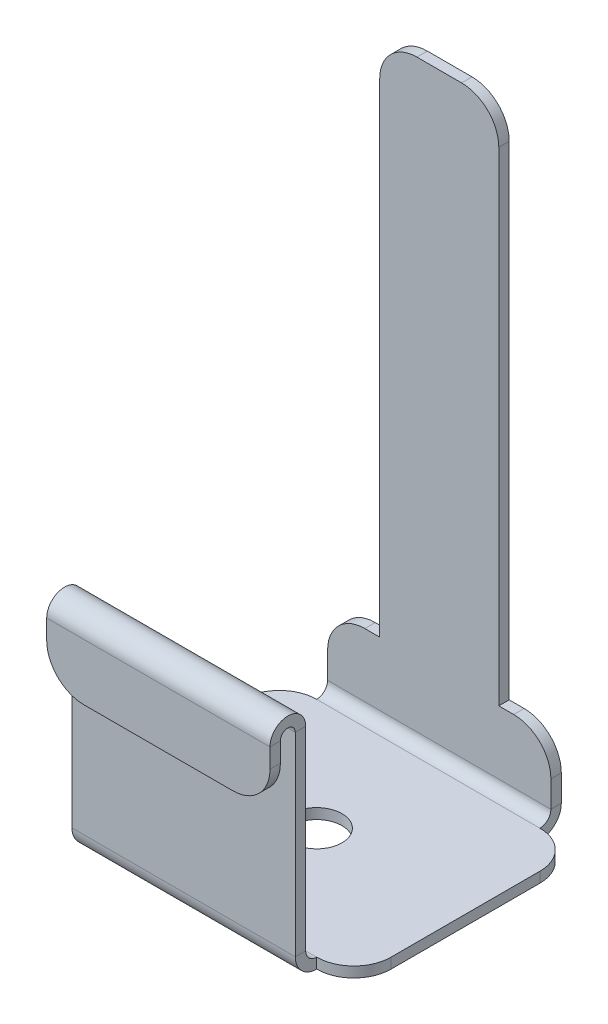
from build123d import *

# Parameters (mm, degrees)
SKETCH1_W             = 20
SKETCH1_H             = 15
BASE_FLANGE1_DEPTH    = 0.7
EDGE_FLANGE1_DEPTH    = 15
SKETCH7_W             = 8
SKETCH7_H             = 35
TAB1_DEPTH            = 0.7
EDGE_FLANGE2_DEPTH    = 15
HEM1_START            = -7.5
HEM1_DEPTH            = 15
HEM1_2_DEPTH          = 15
SKETCH13_R            = 1.7
CUT_EXTRUDE1_DEPTH    = 0.7
BREAK_CORNER2_START   = -8.9366
BREAK_CORNER2_DEPTH   = 0.7
BREAK_CORNER2_START_2 = 9.9366
BREAK_CORNER2_2_DEPTH = 0.7
BREAK_CORNER2_START_3 = -0.7
BREAK_CORNER2_3_DEPTH = 0.7


# Read off the part's stored shape, not the designer's step: Hem1, Break-Corner2
# Sheet-metal steps are written as plain solids
with BuildPart() as part:
    # Sketch1 → Base-Flange1 (new body)
    with BuildSketch(Plane(origin=(0, 0, 0), x_dir=(1, 0, 0), z_dir=(0, 1, 0))):
        Rectangle(SKETCH1_W, SKETCH1_H)
    extrude(amount=-BASE_FLANGE1_DEPTH)

    # Edge-Flange1 section (across the edge) → Edge-Flange1 (add)
    with BuildSketch(Plane(origin=(7.5, 0, -8.2366), x_dir=(0, 0, 1), z_dir=(-1, 0, 0))):
        with BuildLine():
            Line((-0.7, 0.7366), (-0.7, 5))
            Line((-0.7, 5), (0, 5))
            Line((0, 5), (0, 0.7366))
            ThreePointArc((0, 0.7366), (0.215745145, 0.215745145), (0.7366, 0))
            Line((0.7366, 0), (0.7366, -0.7))
            ThreePointArc((0.7366, -0.7), (-0.279229602, -0.279229602), (-0.7, 0.7366))
        make_face()
    extrude(amount=EDGE_FLANGE1_DEPTH)

    # Sketch7 → Tab1 (add)
    with BuildSketch(Plane.XY.offset(-8.2366)):
        with Locations((0, 22.5)):
            Rectangle(SKETCH7_W, SKETCH7_H)
    extrude(amount=-TAB1_DEPTH)

    # Edge-Flange2 section (across the edge) → Edge-Flange2 (add)
    with BuildSketch(Plane(origin=(-7.5, 0, 8.2366), x_dir=(0, 0, -1), z_dir=(1, 0, 0))):
        with BuildLine():
            Line((-0.7, 0.7366), (-0.7, 15))
            Line((-0.7, 15), (0, 15))
            Line((0, 15), (0, 0.7366))
            ThreePointArc((0, 0.7366), (0.215745145, 0.215745145), (0.7366, 0))
            Line((0.7366, 0), (0.7366, -0.7))
            ThreePointArc((0.7366, -0.7), (-0.279229602, -0.279229602), (-0.7, 0.7366))
        make_face()
    extrude(amount=EDGE_FLANGE2_DEPTH)

    # Hem1 outline → Hem1 (cut)
    with BuildSketch(Plane.YZ.offset(HEM1_START)):
        with BuildLine():
            Line((15, 8.9366), (14.890871211, 8.9366))
            ThreePointArc((14.890871211, 8.9366), (14.44807407, 8.426649506), (13.8, 8.2366))
            Line((13.8, 8.2366), (15, 8.2366))
            Line((15, 8.2366), (15, 8.9366))
        make_face()
    extrude(amount=HEM1_DEPTH, mode=Mode.SUBTRACT)

    # Hem1 2 outline → Hem1 2 (add)
    with BuildSketch(Plane.YZ.offset(HEM1_START)):
        with BuildLine():
            Line((10, 10.6366), (10, 9.9366))
            Line((10, 9.9366), (13.8, 9.9366))
            ThreePointArc((13.8, 9.9366), (14.3, 9.4366), (13.8, 8.9366))
            Line((13.8, 8.9366), (14.890871211, 8.9366))
            ThreePointArc((14.890871211, 8.9366), (14.809950494, 10.08467407), (13.8, 10.6366))
            Line((13.8, 10.6366), (10, 10.6366))
        make_face()
    extrude(amount=HEM1_2_DEPTH)

    # Sketch13 → Cut-Extrude1 (cut)
    with BuildSketch(Plane(origin=(0, 0, 0), x_dir=(1, 0, 0), z_dir=(0, 1, 0))):
        with Locations(Location((0, 0, 0), (0, 0, 270))):
            Circle(SKETCH13_R)
    extrude(amount=-CUT_EXTRUDE1_DEPTH, mode=Mode.SUBTRACT)

    # Break-Corner2 outline → Break-Corner2 (cut)
    with BuildSketch(Plane.XY.offset(BREAK_CORNER2_START)):
        with BuildLine():
            Line((7.5, 5), (5.001, 5))
            ThreePointArc((5.001, 5), (6.768059846, 4.268059846), (7.5, 2.501))
            Line((7.5, 2.501), (7.5, 5))
        make_face()
        with BuildLine():
            ThreePointArc((-7.5, 2.501), (-6.768059846, 4.268059846), (-5.001, 5))
            Line((-5.001, 5), (-7.5, 5))
            Line((-7.5, 5), (-7.5, 2.501))
        make_face()
        with BuildLine():
            Line((-4, 40), (-4, 37.501))
            ThreePointArc((-4, 37.501), (-3.268059846, 39.268059846), (-1.501, 40))
            Line((-1.501, 40), (-4, 40))
        make_face()
        with BuildLine():
            ThreePointArc((1.501, 40), (3.268059846, 39.268059846), (4, 37.501))
            Line((4, 37.501), (4, 40))
            Line((4, 40), (1.501, 40))
        make_face()
    extrude(amount=BREAK_CORNER2_DEPTH, mode=Mode.SUBTRACT)

    # Break-Corner2 2 outline → Break-Corner2 2 (cut)
    with BuildSketch(Plane.XY.offset(BREAK_CORNER2_START_2)):
        with BuildLine():
            ThreePointArc((7.5, 12.499), (6.768059846, 10.731940154), (5.001, 10))
            Line((5.001, 10), (7.5, 10))
            Line((7.5, 10), (7.5, 12.499))
        make_face()
        with BuildLine():
            ThreePointArc((-5.001, 10), (-6.768059846, 10.731940154), (-7.5, 12.499))
            Line((-7.5, 12.499), (-7.5, 10))
            Line((-7.5, 10), (-5.001, 10))
        make_face()
    extrude(amount=BREAK_CORNER2_2_DEPTH, mode=Mode.SUBTRACT)

    # Break-Corner2 3 outline → Break-Corner2 3 (cut)
    with BuildSketch(Plane(origin=(0, 0, 0), x_dir=(1, 0, 0), z_dir=(0, 1, 0)).offset(BREAK_CORNER2_START_3)):
        with BuildLine():
            ThreePointArc((7.501, 7.5), (9.268059846, 6.768059846), (10, 5.001))
            Line((10, 5.001), (10, 7.5))
            Line((10, 7.5), (7.501, 7.5))
        make_face()
        with BuildLine():
            ThreePointArc((10, -5.001), (9.268059846, -6.768059846), (7.501, -7.5))
            Line((7.501, -7.5), (10, -7.5))
            Line((10, -7.5), (10, -5.001))
        make_face()
        with BuildLine():
            Line((-10, 7.5), (-10, 5.001))
            ThreePointArc((-10, 5.001), (-9.268059846, 6.768059846), (-7.501, 7.5))
            Line((-7.501, 7.5), (-10, 7.5))
        make_face()
        with BuildLine():
            ThreePointArc((-7.501, -7.5), (-9.268059846, -6.768059846), (-10, -5.001))
            Line((-10, -5.001), (-10, -7.5))
            Line((-10, -7.5), (-7.501, -7.5))
        make_face()
    extrude(amount=BREAK_CORNER2_3_DEPTH, mode=Mode.SUBTRACT)


solid = part.part
